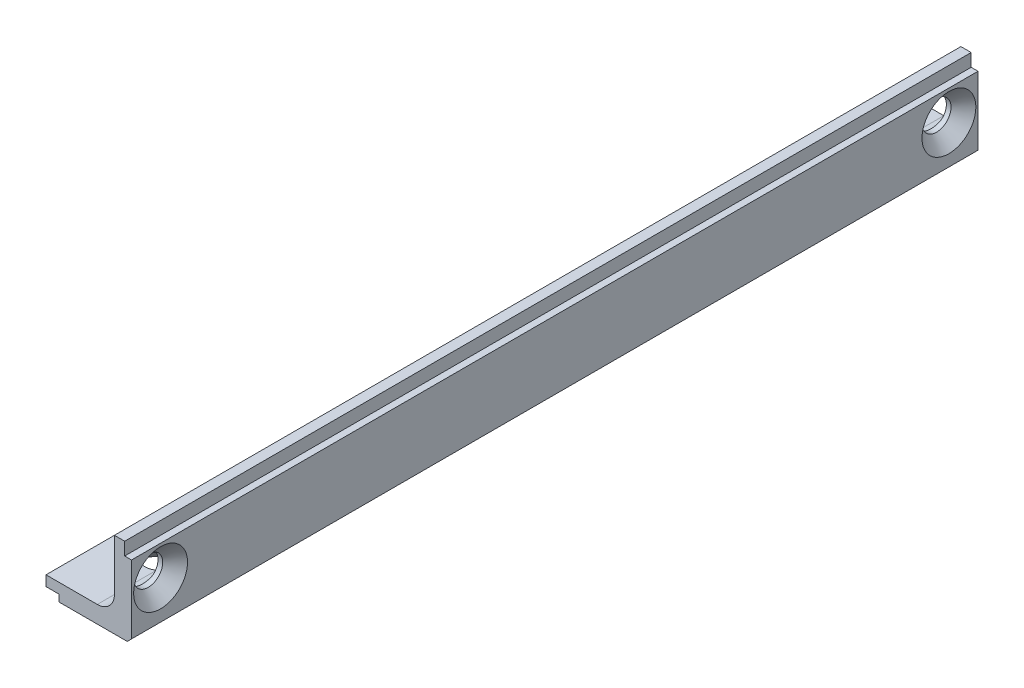
from build123d import *

# Parameters (mm, degrees)
EXTRUDE_THIN1_DEPTH = 99
CHAMFER1_SIZE       = 0.5
FILLET1_R           = 2
SKETCH2_W           = 1.5
SKETCH2_H           = 0.8
SKETCH2_W_2         = 0.8
SKETCH2_H_2         = 1.5
CUT_EXTRUDE1_DEPTH  = 100.814828558


# Read off the part's stored shape, not the designer's step: Mirror1
with BuildPart() as part:
    # Sketch1 → Extrude-Thin1 (new body)
    with BuildSketch(Plane(origin=(0, 0, 0), x_dir=(0, 1, 0), z_dir=(0, 0, 1))):
        Polygon((9, 1), (1, 1), (1, 9), (-1, 9), (-1, -1), (9, -1), align=None)
    extrude(amount=EXTRUDE_THIN1_DEPTH)

    # Chamfer1
    chamfer1_edges = [part.edges().sort_by_distance(p)[0] for p in [
        (1, -1, 49.5),
    ]]
    chamfer(chamfer1_edges, length=CHAMFER1_SIZE)

    # Fillet1
    fillet1_edges = [part.edges().sort_by_distance(p)[0] for p in [
        (-1, 1, 49.5),
    ]]
    fillet(fillet1_edges, radius=FILLET1_R)

    # Sketch2 → Cut-Extrude1 (cut, through all)
    with BuildSketch(Plane.XY.offset(99)):
        with Locations((-8.25, -0.6)):
            Rectangle(SKETCH2_W, SKETCH2_H)
        with Locations((0.6, 8.25)):
            Rectangle(SKETCH2_W_2, SKETCH2_H_2)
    extrude(amount=-CUT_EXTRUDE1_DEPTH, mode=Mode.SUBTRACT)

    # Sketch5 → CSK for M3 Flat Head Machine Screw1 (revolve, cut)
    with BuildSketch(Plane(origin=(1, 4, 3.4), x_dir=(0, 0, -1), z_dir=(0, 1, 0))):
        Polygon((0, 0), (0, 10), (1.7, 10), (1.7, 1.45), (3.15, 0), align=None)
    revolve(axis=Axis((7.35, 4, 3.4), (-1, 0, 0)), mode=Mode.SUBTRACT)

    # Sketch5 at point 2 (carried to point 2, square into its face) → CSK for M3 Flat Head Machine Screw1 at 2 (revolve, cut)
    with BuildSketch(Plane(origin=(-4, -1, 8.3), x_dir=(0, 0, -1), z_dir=(1, 0, 0))):
        Polygon((0, 0), (0, 10), (1.7, 10), (1.7, 1.45), (3.15, 0), align=None)
    revolve(axis=Axis((-4, -7.35, 8.3), (0, 1, 0)), mode=Mode.SUBTRACT)

    # Mirror1 outline → Mirror1 (revolve, cut)
    with BuildSketch(Plane(origin=(-4, 0, 90.7), x_dir=(1, 0, 0), z_dir=(0, 0, 1))):
        Polygon((1.7, 0.45), (1.7, 1.126574026), (0, 1.126574026), (0, -1), (3.15, -1), align=None)
    revolve(axis=Axis((-4, 0, 90.7), (0, 1, 0)), mode=Mode.SUBTRACT)

    # Mirror1 2 outline → Mirror1 2 (revolve, cut)
    with BuildSketch(Plane(origin=(0, 4, 95.6), x_dir=(0, 1, 0), z_dir=(0, 0, -1))):
        Polygon((0, -1.126574026), (1.7, -1.126574026), (1.7, -0.45), (3.15, 1), (0, 1), align=None)
    revolve(axis=Axis((0, 4, 95.6), (1, 0, 0)), mode=Mode.SUBTRACT)


solid = part.part
